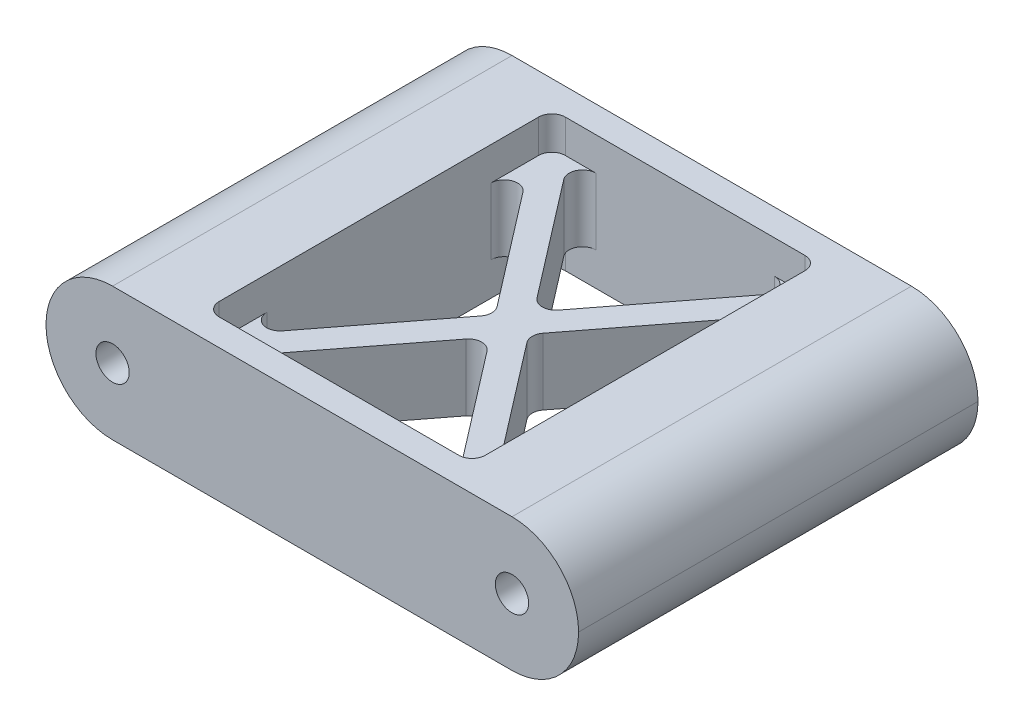
from build123d import *

# Parameters (mm, degrees)
EXTRUDE_425_DEPTH      = 5
EXTRUDE_425_DEPTH_BACK = 5
SKETCH_1_W             = 40
SKETCH_1_H             = 30
SKETCH_5_R             = 1.25
CUT_EXTRUDE_679_DEPTH  = 37.400549446
CUT_EXTRUDE_1219_DEPTH = 27.925824036
SKETCH_7_W             = 20
SKETCH_7_H             = 26
CUT_EXTRUDE_1457_DEPTH = 2.5
FILLET_1_R             = 1
FILLET_2_R             = 1
FILLET_3_R             = 5


with BuildPart() as part:
    # Эскиз1 → Extrude 425 (new, two sides: drawn at the far end of the back side and taken through both)
    with BuildSketch(Plane(origin=(0, 0, 0), x_dir=(1, 0, 0), z_dir=(0, 1, 0)).offset(-EXTRUDE_425_DEPTH_BACK)):
        Rectangle(SKETCH_1_W, SKETCH_1_H)
    extrude(amount=EXTRUDE_425_DEPTH + EXTRUDE_425_DEPTH_BACK)

    # Эскиз5 → Cut-Extrude 679 (cut, through all)
    with BuildSketch(Plane.XY.offset(15)):
        with Locations((-15, 0)):
            Circle(SKETCH_5_R)
        with Locations((15, 0)):
            Circle(SKETCH_5_R)
    extrude(amount=-CUT_EXTRUDE_679_DEPTH, mode=Mode.SUBTRACT)

    # Эскиз6 → Cut-Extrude 1219 (cut, through all)
    with BuildSketch(Plane(origin=(0, 5, 0), x_dir=(1, 0, 0), z_dir=(0, 1, 0))):
        Polygon((-8.738367733, 13), (8.738367733, 13), (0, 1.640121947), align=None)
        Polygon((10, 11.359878053), (10, -11.359878053), (1.261632267, 0), align=None)
        Polygon((-8.738367733, -13), (8.738367733, -13), (0, -1.640121947), align=None)
        Polygon((-10, 11.359878053), (-10, -11.359878053), (-1.261632267, 0), align=None)
    extrude(amount=-CUT_EXTRUDE_1219_DEPTH, mode=Mode.SUBTRACT)

    # Эскиз7 → Cut-Extrude 1457 (cut)
    with BuildSketch(Plane(origin=(0, 5, 0), x_dir=(1, 0, 0), z_dir=(0, 1, 0))):
        Rectangle(SKETCH_7_W, SKETCH_7_H)
    cut_extrude_1457 = extrude(amount=-CUT_EXTRUDE_1457_DEPTH, mode=Mode.SUBTRACT)

    # Зеркальное отражение1: Cut-Extrude 1457 across plane
    add(cut_extrude_1457.mirror(Plane.ZX), mode=Mode.SUBTRACT)

    # Скругление1
    fillet_1_edges = [part.edges().sort_by_distance(p)[0] for p in [
        (8.738367733, 0, 13),
        (-8.738367733, 0, 13),
        (-10, 0, 11.359878053),
        (-10, 0, -11.359878053),
        (-8.738367733, 0, -13),
        (8.738367733, 0, -13),
        (10, 0, -11.359878053),
        (10, 0, 11.359878053),
        (-10, -3.75, -13),
        (-10, -3.75, 13),
        (10, -3.75, 13),
        (10, -3.75, -13),
        (10, 3.75, -13),
        (-10, 3.75, -13),
        (-10, 3.75, 13),
        (10, 3.75, 13),
    ]]
    fillet(fillet_1_edges, radius=FILLET_1_R)

    # Скругление2
    fillet_2_edges = [part.edges().sort_by_distance(p)[0] for p in [
        (0, 0, 1.640121947),
        (-1.261632267, 0, 0),
        (0, 0, -1.640121947),
        (1.261632267, 0, 0),
    ]]
    fillet(fillet_2_edges, radius=FILLET_2_R)

    # Скругление3
    fillet_3_edges = [part.edges().sort_by_distance(p)[0] for p in [
        (-20, -5, 0),
        (-20, 5, 0),
        (20, -5, 0),
        (20, 5, 0),
    ]]
    fillet(fillet_3_edges, radius=FILLET_3_R - 0.0001)  # a hair under: the kernel refuses the full size


solid = part.part
